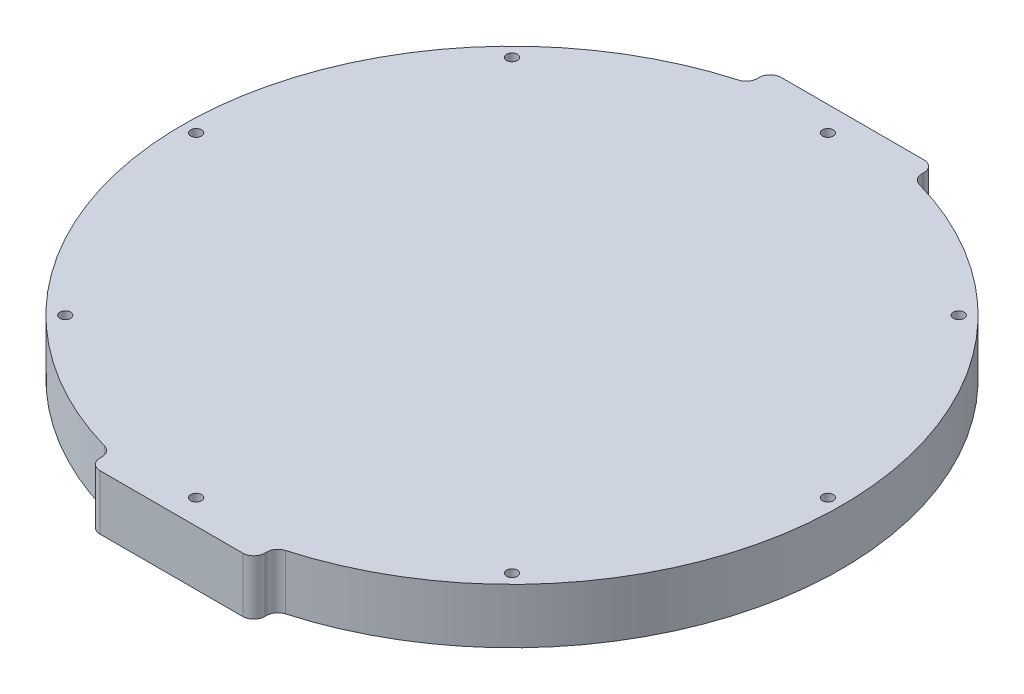
from build123d import *

# Parameters (mm, degrees)
SKETCH2_R                = 76.2
BOSS_EXTRUDE1_DEPTH      = 12.7
BOSS_EXTRUDE2_DEPTH      = 78.74
BOSS_EXTRUDE2_DEPTH_BACK = 78.74
FILLET1_R                = 2.54
SKETCH4_R                = 1.24968
CUT_EXTRUDE1_DEPTH       = 111.307377813


with BuildPart() as part:
    # Sketch2 → Boss-Extrude1 (new body)
    with BuildSketch(Plane(origin=(0, 0, 0), x_dir=(1, 0, 0), z_dir=(0, 1, 0))):
        Circle(SKETCH2_R)
    extrude(amount=BOSS_EXTRUDE1_DEPTH)

    # Sketch3 → Boss-Extrude2 (add, two sides: drawn at the far end of the back side and taken through both)
    with BuildSketch(Plane.XY.offset(-BOSS_EXTRUDE2_DEPTH_BACK)):
        Polygon((0, 0), (-19.05, 0), (-19.05, 12.7), (19.05, 12.7), (19.05, 0), align=None)
    extrude(amount=BOSS_EXTRUDE2_DEPTH + BOSS_EXTRUDE2_DEPTH_BACK)

    # Fillet1
    fillet1_edges = [part.edges().sort_by_distance(p)[0] for p in [
        (19.05, 6.35, 73.780332745),
        (19.05, 6.35, 78.74),
        (-19.05, 6.35, 73.780332745),
        (-19.05, 6.35, 78.74),
        (-19.05, 6.35, -73.780332745),
        (-19.05, 6.35, -78.74),
        (19.05, 6.35, -73.780332745),
        (19.05, 6.35, -78.74),
    ]]
    fillet(fillet1_edges, radius=FILLET1_R)

    # Sketch4 → Cut-Extrude1 (cut, through all)
    with BuildSketch(Plane(origin=(0, 12.7, 0), x_dir=(1, 0, 0), z_dir=(0, 1, 0))):
        with Locations((73.025, 0)):
            Circle(SKETCH4_R)
        with Locations((51.636472696, -51.636472696)):
            Circle(SKETCH4_R)
        with Locations((0, -73.025)):
            Circle(SKETCH4_R)
        with Locations((-51.636472696, -51.636472696)):
            Circle(SKETCH4_R)
        with Locations((-73.025, 0)):
            Circle(SKETCH4_R)
        with Locations((-51.636472696, 51.636472696)):
            Circle(SKETCH4_R)
        with Locations((0, 73.025)):
            Circle(SKETCH4_R)
        with Locations((51.636472696, 51.636472696)):
            Circle(SKETCH4_R)
    extrude(amount=-CUT_EXTRUDE1_DEPTH, mode=Mode.SUBTRACT)


solid = part.part
